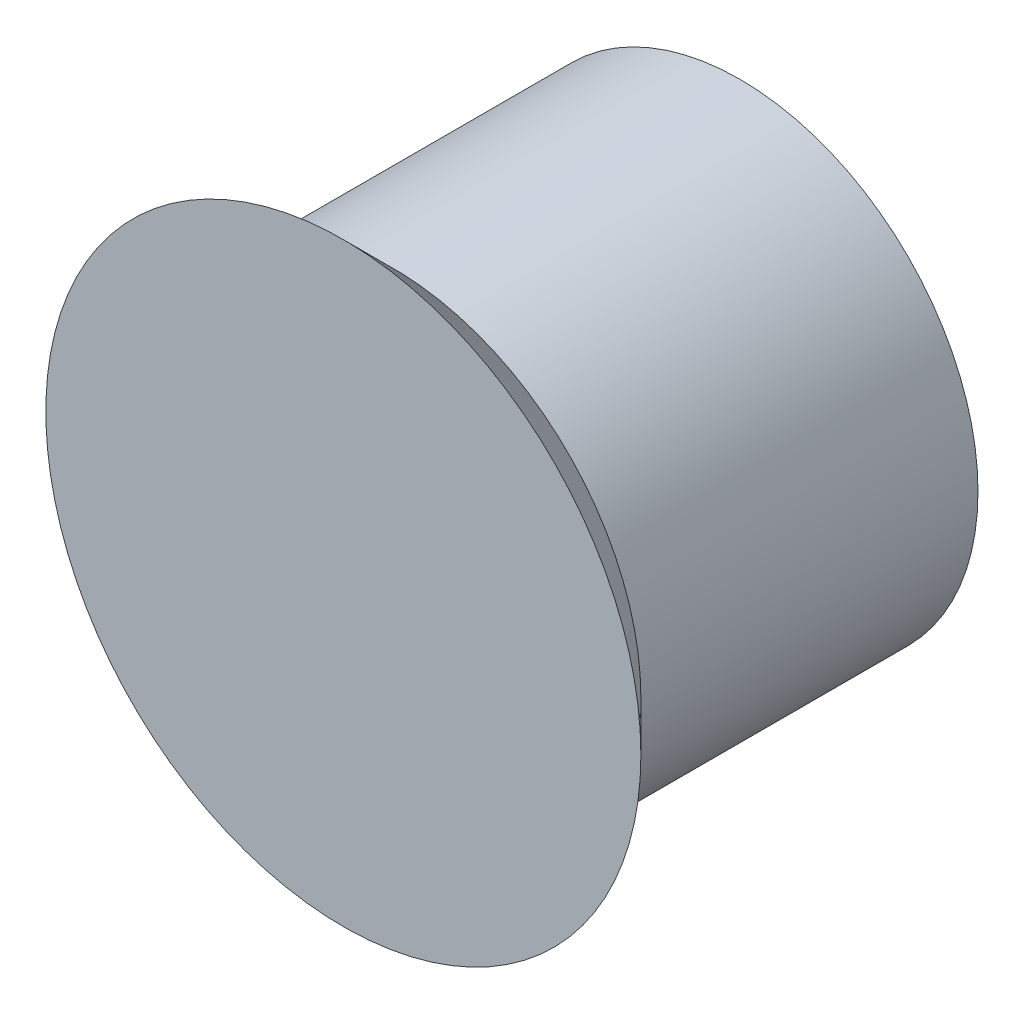
from build123d import *

# Parameters (mm, degrees)
IZIM1_R                     = 2.4
Y_KSEKLIK_EKSTR_ZYON1_DEPTH = 3.5
IZIM2_R                     = 2.500471533
Y_KSEKLIK_EKSTR_ZYON2_DEPTH = 0.5
Y_KSEKLIK_EKSTR_ZYON2_DRAFT = -45


with BuildPart() as part:
    # Çizim1 → Yükseklik-Ekstrüzyon1 (new body)
    with BuildSketch(Plane.XY):
        Circle(IZIM1_R)
    extrude(amount=Y_KSEKLIK_EKSTR_ZYON1_DEPTH)


with BuildPart() as y_kseklik_ekstr_zyon2_tool:
    # Çizim2 → Yükseklik-Ekstrüzyon2 (with draft: the straight prism first)
    with BuildSketch(Plane.XY.offset(3.5)):
        Circle(IZIM2_R)
    extrude(amount=Y_KSEKLIK_EKSTR_ZYON2_DEPTH)
    # Yükseklik-Ekstrüzyon2: the draft: its side faces are tilted about the plane it starts from
    y_kseklik_ekstr_zyon2_sides = [y_kseklik_ekstr_zyon2_tool.faces().sort_by_distance(p)[0] for p in [
        (-2.500471533, 0, 3.75),
    ]]
    draft(y_kseklik_ekstr_zyon2_sides, Plane.XY.offset(3.5), Y_KSEKLIK_EKSTR_ZYON2_DRAFT)


with BuildPart() as part_1:
    add(part.part)

    # Yükseklik-Ekstrüzyon2: add y_kseklik_ekstr_zyon2_tool
    add(y_kseklik_ekstr_zyon2_tool.part)


solid = part_1.part
